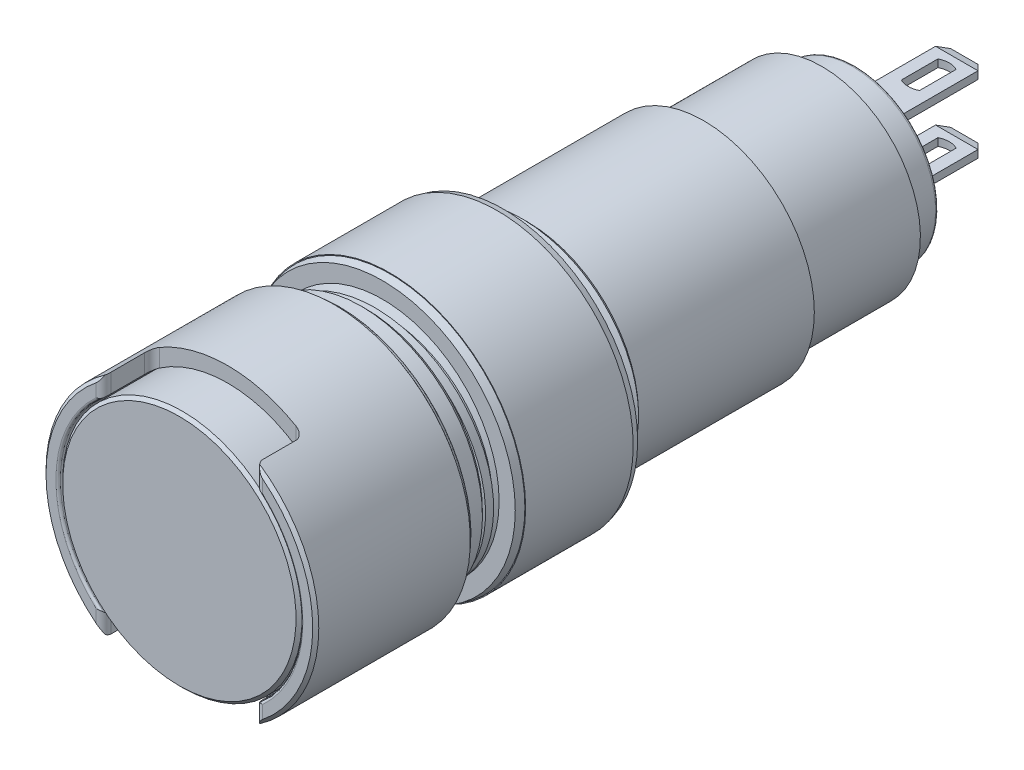
from build123d import *
from OCP.BRepFilletAPI import BRepFilletAPI_MakeChamfer

# Parameters (mm, degrees)
SPLIT1_START            = -34
SPLIT1_2_OUTLINE_R      = 7.7
SPLIT1_2_DEPTH          = 32.3
CUT_SWEEP1_PITCH        = 1.5
CUT_EXTRUDE1_DEPTH      = 37.304269721
CUT_EXTRUDE1_DEPTH_BACK = 37.304269721
SKETCH7_W               = 2.8
SKETCH7_H               = 0.5
BOSS_EXTRUDE1_DEPTH     = 7.2
CHAMFER1_SIZE           = 0.5
CHAMFER2_SIZE           = 0.5
CHAMFER2_SIZE2          = 0.133974596
CUT_EXTRUDE2_DEPTH      = 44.121224514
CUT_EXTRUDE2_DEPTH_BACK = 44.121224514


# Read off the part's stored shape, not the designer's step: Split1
with BuildPart() as part:
    # Sketch3 → Revolve1 (revolve)
    with BuildSketch(Plane(origin=(0, 0, 0), x_dir=(0, 0, -1), z_dir=(1, 0, 0))):
        with BuildLine():
            Line((-10.45, 8), (-2.4, 8))
            ThreePointArc((-2.4, 8), (-2.253553391, 7.646446609), (-1.9, 7.5))
            Line((-1.9, 7.5), (-1.3, 7.5))
            Line((-1.3, 7.5), (-0.7, 6.9))
            Line((-0.7, 6.9), (-0.7, 0))
            Line((-0.7, 0), (34, 0))
            Line((34, 0), (34, 5.3))
            ThreePointArc((34, 5.3), (33.941421356, 5.441421356), (33.8, 5.5))
            Line((33.8, 5.5), (31.8, 5.5))
            Line((31.8, 5.5), (31.8, 6.5))
            Line((31.8, 6.5), (24, 6.5))
            Line((24, 6.5), (24, 7.3))
            Line((24, 7.3), (12.4, 7.3))
            Line((12.4, 7.3), (12, 7.7))
            Line((12, 7.7), (1.7, 7.7))
            Line((1.7, 7.7), (1.4, 8))
            Line((1.4, 8), (-0.4, 8))
            Line((-0.4, 8), (-0.4, 9))
            Line((-0.4, 9), (-10.4, 9))
            Line((-10.4, 9), (-10.6, 8.8))
            Line((-10.6, 8.8), (-10.6, 8.15))
            ThreePointArc((-10.6, 8.15), (-10.556066017, 8.043933983), (-10.45, 8))
        make_face()
    revolve(axis=Axis((0, 0, -41.2), (0, 0, 1)))

    # Split1 2 outline → Split1 2 (cut)
    with BuildSketch(Plane.XY.offset(SPLIT1_START)):
        Circle(SPLIT1_2_OUTLINE_R)
    extrude(amount=SPLIT1_2_DEPTH, mode=Mode.SUBTRACT)


with BuildPart() as body_2:
    # Split1 outline → Split1 (revolve)
    with BuildSketch(Plane.XZ):
        with BuildLine():
            Line((0, -12.4), (0, -34))
            Line((0, -34), (5.3, -34))
            ThreePointArc((5.3, -34), (5.441421356, -33.941421356), (5.5, -33.8))
            Line((5.5, -33.8), (5.5, -31.8))
            Line((5.5, -31.8), (6.5, -31.8))
            Line((6.5, -31.8), (6.5, -24))
            Line((6.5, -24), (7.3, -24))
            Line((7.3, -24), (7.3, -12.4))
            Line((7.3, -12.4), (0, -12.4))
        make_face()
    revolve(axis=Axis((0, 0, 0), (0, 0, 1)))


with BuildPart() as body_3:
    # Split1 3 outline → Split1 3 (revolve)
    with BuildSketch(Plane.XZ):
        Polygon((0, -1.7), (0, -12.4), (7.3, -12.4), (7.7, -12), (7.7, -1.7), align=None)
    revolve(axis=Axis((0, 0, 0), (0, 0, 1)))

    # Cut-Sweep1: the profile of Sketch5 screwed along a right-hand helix of 8.066667 turns, 8 arcs to a turn; built about Z, then put on its axis
    cut_sweep1_z = Axis((0, 0, 0), (0, 0, 1))
    cut_sweep1_corners = [(7.025721421, 0, -0.75), (7.025721421, 0, -0.5625), (8.081189882, 0, 0.046875), (8.081189882, 0, -1.359375)]
    with BuildLine(mode=Mode.PRIVATE) as cut_sweep1_profile:
        Line(cut_sweep1_corners[0], cut_sweep1_corners[1])
        Line(cut_sweep1_corners[1], cut_sweep1_corners[2])
        Line(cut_sweep1_corners[2], cut_sweep1_corners[3])
        Line(cut_sweep1_corners[3], cut_sweep1_corners[0])
    cut_sweep1_cap = Face(cut_sweep1_profile.wire())
    cut_sweep1_turn_angles = [0, 22.5, 45, 67.5, 90, 112.5, 135, 157.5, 180, 202.5, 225, 247.5, 270, 292.5, 315, 337.5, 360]
    cut_sweep1_turn_weights = [1, 0.9238795325112867, 1, 0.9238795325112867, 1, 0.9238795325112867, 1, 0.9238795325112867, 1, 0.9238795325112867, 1, 0.9238795325112867, 1, 0.9238795325112867, 1, 0.9238795325112867, 1]
    cut_sweep1_turn_rails = [Edge.make_bspline([Vector(p[0], p[1], 0).rotate(cut_sweep1_z, cut_sweep1_turn_angles[k]) / cut_sweep1_turn_weights[k] + Vector(0, 0, p[2] + CUT_SWEEP1_PITCH * cut_sweep1_turn_angles[k] / 360) for k in range(17)], [0, 0, 0, 1, 1, 2, 2, 3, 3, 4, 4, 5, 5, 6, 6, 7, 7, 8, 8, 8], 2, cut_sweep1_turn_weights) for p in cut_sweep1_corners]
    cut_sweep1_turn_sides = [Face.make_surface_from_curves(cut_sweep1_turn_rails[p[0]], cut_sweep1_turn_rails[p[1]]) for p in [(0, 1), (1, 2), (2, 3), (3, 0)]]
    cut_sweep1_last_angles = [2880, 2892, 2904]
    cut_sweep1_last_weights = [1, 0.9781476007338057, 1]
    cut_sweep1_last_rails = [Edge.make_bspline([Vector(p[0], p[1], 0).rotate(cut_sweep1_z, cut_sweep1_last_angles[k]) / cut_sweep1_last_weights[k] + Vector(0, 0, p[2] + CUT_SWEEP1_PITCH * cut_sweep1_last_angles[k] / 360) for k in range(3)], [0, 0, 0, 1, 1, 1], 2, cut_sweep1_last_weights) for p in cut_sweep1_corners]
    cut_sweep1_last_sides = [Face.make_surface_from_curves(cut_sweep1_last_rails[p[0]], cut_sweep1_last_rails[p[1]]) for p in [(0, 1), (1, 2), (2, 3), (3, 0)]]
    cut_sweep1 = Plane(origin=(0, 0, -1.7), x_dir=(0, 1, 0), z_dir=(0, 0, -1)) * Solid(Shell([*[p.moved(Location((0, 0, CUT_SWEEP1_PITCH * i))) for i in range(8) for p in cut_sweep1_turn_sides], *cut_sweep1_last_sides, cut_sweep1_cap, cut_sweep1_cap.rotate(cut_sweep1_z, 2904).moved(Location((0, 0, CUT_SWEEP1_PITCH * 2904 / 360)))]))
    add(cut_sweep1, mode=Mode.SUBTRACT)

    # Combine1: union part, body 2
    add(part.part)
    add(body_2.part)

    # Sketch6 → Cut-Extrude1 (cut, two sides: drawn at the far end of the back side and taken through both)
    with BuildSketch(Plane(origin=(0, 0, 0), x_dir=(1, 0, 0), z_dir=(0, 1, 0)).offset(-CUT_EXTRUDE1_DEPTH_BACK)):
        with BuildLine():
            Line((-4.5, -7.4), (4.5, -7.4))
            ThreePointArc((4.5, -7.4), (4.853553391, -7.546446609), (5, -7.9))
            Line((5, -7.9), (5, -10.1))
            ThreePointArc((5, -10.1), (5.146446609, -10.453553391), (5.5, -10.6))
            Line((5.5, -10.6), (-5.5, -10.6))
            ThreePointArc((-5.5, -10.6), (-5.146446609, -10.453553391), (-5, -10.1))
            Line((-5, -10.1), (-5, -7.9))
            ThreePointArc((-5, -7.9), (-4.853553391, -7.546446609), (-4.5, -7.4))
        make_face()
    extrude(amount=CUT_EXTRUDE1_DEPTH + CUT_EXTRUDE1_DEPTH_BACK, mode=Mode.SUBTRACT)

    # Sketch7 → Boss-Extrude1 (add)
    with BuildSketch(Plane(origin=(0, 0, -34), x_dir=(-1, 0, 0), z_dir=(0, 0, -1))):
        with Locations((0, 2.25)):
            Rectangle(SKETCH7_W, SKETCH7_H)
        with Locations((0, -2.25)):
            Rectangle(SKETCH7_W, SKETCH7_H)
    extrude(amount=BOSS_EXTRUDE1_DEPTH)

    # Chamfer1
    chamfer1_edges = [body_3.edges().sort_by_distance(p)[0] for p in [
        (1.4, 2.25, -41.2),
        (-1.4, 2.25, -41.2),
        (1.4, -2.25, -41.2),
        (-1.4, -2.25, -41.2),
    ]]
    chamfer(chamfer1_edges, length=CHAMFER1_SIZE)

    # Chamfer2: one chamfer whose edges measure the first distance from different faces: ONE call of the kernel's chamfer builder (chamfer() names one face for all edges)
    chamfer2_edges_1 = [body_3.edges().sort_by_distance(p)[0] for p in [
        (0, -2.5, -41.2),
    ]]
    chamfer2_side_1 = [body_3.faces().sort_by_distance(p)[0] for p in [
        (0, -2.5, -37.556889335),
    ]]
    chamfer2_edges_2 = [body_3.edges().sort_by_distance(p)[0] for p in [
        (0, -2, -41.2),
    ]]
    chamfer2_side_2 = [body_3.faces().sort_by_distance(p)[0] for p in [
        (0, -2, -37.556889335),
    ]]
    chamfer2_edges_3 = [body_3.edges().sort_by_distance(p)[0] for p in [
        (0, 2, -41.2),
    ]]
    chamfer2_side_3 = [body_3.faces().sort_by_distance(p)[0] for p in [
        (0, 2, -37.556889335),
    ]]
    chamfer2_edges_4 = [body_3.edges().sort_by_distance(p)[0] for p in [
        (0, 2.5, -41.2),
    ]]
    chamfer2_side_4 = [body_3.faces().sort_by_distance(p)[0] for p in [
        (0, 2.5, -37.556889335),
    ]]
    chamfer2 = BRepFilletAPI_MakeChamfer(body_3.part.solid().wrapped)
    for e in chamfer2_edges_1:
        chamfer2.Add(CHAMFER2_SIZE, CHAMFER2_SIZE2, e.wrapped, chamfer2_side_1[0].wrapped)  # the first distance lies on this face
    for e in chamfer2_edges_2:
        chamfer2.Add(CHAMFER2_SIZE, CHAMFER2_SIZE2, e.wrapped, chamfer2_side_2[0].wrapped)  # the first distance lies on this face
    for e in chamfer2_edges_3:
        chamfer2.Add(CHAMFER2_SIZE, CHAMFER2_SIZE2, e.wrapped, chamfer2_side_3[0].wrapped)  # the first distance lies on this face
    for e in chamfer2_edges_4:
        chamfer2.Add(CHAMFER2_SIZE, CHAMFER2_SIZE2, e.wrapped, chamfer2_side_4[0].wrapped)  # the first distance lies on this face
    add(Compound.cast(chamfer2.Shape()), mode=Mode.REPLACE)

    # Sketch8 → Cut-Extrude2 (cut, two sides: drawn at the far end of the back side and taken through both)
    with BuildSketch(Plane(origin=(0, 0, 0), x_dir=(1, 0, 0), z_dir=(0, 1, 0)).offset(-CUT_EXTRUDE2_DEPTH_BACK)):
        with BuildLine():
            Line((-0.6, 40.059338662), (-0.6, 37.640661338))
            ThreePointArc((-0.6, 37.640661338), (0, 37.5), (0.6, 37.640661338))
            Line((0.6, 37.640661338), (0.6, 40.059338662))
            ThreePointArc((0.6, 40.059338662), (0, 40.2), (-0.6, 40.059338662))
        make_face()
    extrude(amount=CUT_EXTRUDE2_DEPTH + CUT_EXTRUDE2_DEPTH_BACK, mode=Mode.SUBTRACT)


with BuildPart() as body_2_2:
    # Sketch9 → Revolve2 (revolve)
    with BuildSketch(Plane(origin=(0, 0, 0), x_dir=(0, 0, -1), z_dir=(1, 0, 0))):
        Polygon((-10.4, 7.9), (-10.6, 7.7), (-10.6, 0), (-6.1, 0), (-6.1, 7.9), align=None)
    revolve(axis=Axis((0, 0, 0), (0, 0, 1)))


with BuildPart() as body_3_2:
    # Sketch10 → Revolve3 (revolve)
    with BuildSketch(Plane(origin=(0, 0, 0), x_dir=(0, 0, -1), z_dir=(1, 0, 0))):
        with BuildLine():
            Line((-0.3, 8.7), (-0.225, 8.7))
            Line((-0.225, 8.7), (-0.225, 8.2))
            ThreePointArc((-0.225, 8.2), (-0.2, 8.175), (-0.175, 8.2))
            Line((-0.175, 8.2), (-0.175, 8.7))
            Line((-0.175, 8.7), (-0.1, 8.7))
            ThreePointArc((-0.1, 8.7), (-0.029289322, 8.670710678), (0, 8.6))
            Line((0, 8.6), (0, 8.2))
            ThreePointArc((0, 8.2), (-0.2, 8), (-0.4, 8.2))
            Line((-0.4, 8.2), (-0.4, 8.6))
            ThreePointArc((-0.4, 8.6), (-0.370710678, 8.670710678), (-0.3, 8.7))
        make_face()
    revolve(axis=Axis((0, 0, 0), (0, 0, 1)))


with BuildPart() as body_4:
    # Sketch11 → Revolve4 (revolve)
    with BuildSketch(Plane(origin=(0, 0, 0), x_dir=(0, 0, -1), z_dir=(1, 0, 0))):
        Polygon((3.3, 8.95), (10.4, 8.95), (10.8, 8.842820323), (10.8, 7.7), (2.8, 7.7), (2.8, 8.766025404), (3.3, 8.9), align=None)
    revolve(axis=Axis((0, 0, 0), (0, 0, -1)))


solid = Compound([body_3.part, body_2_2.part, body_3_2.part, body_4.part])
